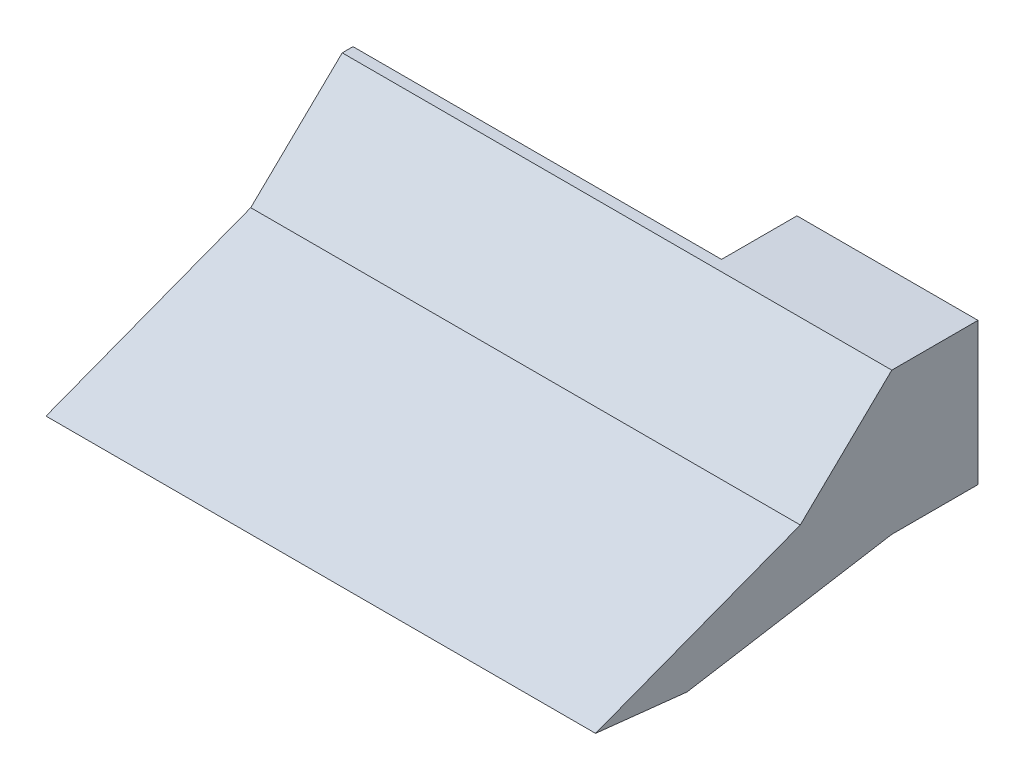
from build123d import *

# Parameters (mm, degrees)
SIDE_BASE_DEPTH            = 1
SIDE_BASE_2_COUNT          = 2
SIDE_BASE_2_PITCH          = 50
FRONT_BACK_WALLS_REACH     = 60.566
BASE_SKETCH_W              = 51
BASE_SKETCH_H              = 13.2
BASE_SKETCH_W_2            = 14.8
BASE_SKETCH_H_2            = 10.796042654
BASE_DEPTH                 = 1
ATTACHMENT_BASE_SKETCH_W   = 16.8
ATTACHMENT_BASE_SKETCH_H   = 13.2
ATTACHMENT_BASE_SKETCH_W_2 = 14.8
ATTACHMENT_BASE_SKETCH_H_2 = 10.796042654
ATTACHMENT_BASE_DEPTH      = 7


with BuildPart() as part:
    # Side base sketch → Side base (new body)
    with BuildSketch(Plane.ZY):
        Polygon((0, 13.2), (8.491348573, 5), (19.491348573, 0.8030407), (27.491348573, -2.249293336), (19, -3.166666667), (6, -1), (0, 0), align=None)
    extrude(amount=-SIDE_BASE_DEPTH)


with BuildPart() as side_base_2_1:
    # Side base 2: pattern copy
    add(part.part.moved(Location(Vector(1, 0, 0) * (1 * SIDE_BASE_2_PITCH))))

    # Wall base sketch → Front back walls (add, up to next)
    with BuildSketch(Plane(origin=(1, 0, 0), x_dir=(0, 0, -1), z_dir=(1, 0, 0)), mode=Mode.PRIVATE) as front_back_walls_sk1:
        Polygon((0, 11.809836409), (-7.943800402, 4.138597531), (-25.305149477, -2.485482055), (-27.491348573, -2.249293336), (-8.491348573, 5), (0, 13.2), align=None)
    front_back_walls_tool1 = extrude(front_back_walls_sk1.sketch, amount=FRONT_BACK_WALLS_REACH, mode=Mode.PRIVATE) - side_base_2_1.part
    # Wall base sketch → Front back walls (add, up to next)
    with BuildSketch(Plane(origin=(1, 0, 0), x_dir=(0, 0, -1), z_dir=(1, 0, 0)), mode=Mode.PRIVATE) as front_back_walls_sk2:
        Polygon((0, 1.013793755), (-19, -2.152872912), (-19, -3.166666667), (0, 0), align=None)
    front_back_walls_tool2 = extrude(front_back_walls_sk2.sketch, amount=FRONT_BACK_WALLS_REACH, mode=Mode.PRIVATE) - side_base_2_1.part

    add(part.part)  # Front back walls merges part
    add(front_back_walls_tool1.solids().sort_by_distance((1, 8.201898, 4.191769))[0])
    add(front_back_walls_tool2.solids().sort_by_distance((1, -1.076436, 9.5))[0])

    # Base sketch → Base (add)
    with BuildSketch(Plane(origin=(0, 0, 0), x_dir=(-1, 0, 0), z_dir=(0, 0, -1))):
        with Locations((-25.5, 6.6)):
            Rectangle(BASE_SKETCH_W, BASE_SKETCH_H)
        with Locations((-42.6, 6.411815082)):
            Rectangle(BASE_SKETCH_W_2, BASE_SKETCH_H_2, mode=Mode.SUBTRACT)
    extrude(amount=BASE_DEPTH)

    # Attachment base sketch → Attachment base (add)
    with BuildSketch(Plane(origin=(0, 0, -1), x_dir=(-1, 0, 0), z_dir=(0, 0, -1))):
        with Locations((-42.6, 6.6)):
            Rectangle(ATTACHMENT_BASE_SKETCH_W, ATTACHMENT_BASE_SKETCH_H)
        with Locations((-42.6, 6.411815082)):
            Rectangle(ATTACHMENT_BASE_SKETCH_W_2, ATTACHMENT_BASE_SKETCH_H_2, mode=Mode.SUBTRACT)
    extrude(amount=ATTACHMENT_BASE_DEPTH)


solid = side_base_2_1.part
